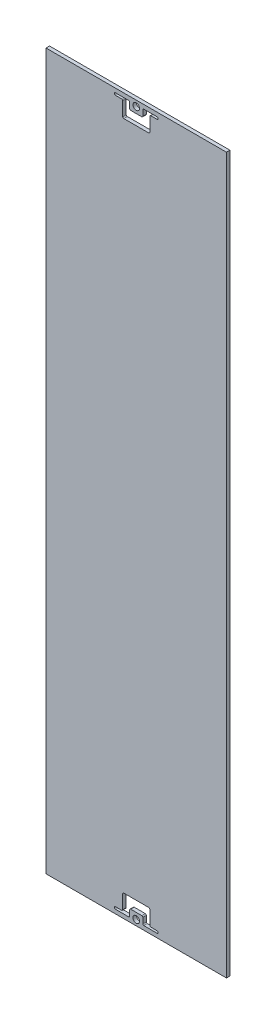
from build123d import *

# Parameters (mm, degrees)
SKETCH1_W           = 82.5
SKETCH1_H           = 327
PCB_EXTRUDE_DEPTH   = 1.6
SOLAR_HOLE_SKETCH_R = 1.5
SOLAR_HOLE_DEPTH    = 169.630876473


with BuildPart() as part:
    # Sketch1 → PCB Extrude (new body)
    with BuildSketch(Plane.XY):
        Rectangle(SKETCH1_W, SKETCH1_H)
    extrude(amount=PCB_EXTRUDE_DEPTH)

    # Solar Hole sketch → Solar Hole (cut, through all)
    with BuildSketch(Plane.XY):
        with Locations((0, -160.95)):
            Circle(SOLAR_HOLE_SKETCH_R)
        with BuildLine():
            Line((-5.7, -153.35), (5.7, -153.35))
            ThreePointArc((5.7, -153.35), (6.053553391, -153.496446609), (6.2, -153.85))
            Line((6.2, -153.85), (6.2, -160.15))
            ThreePointArc((6.2, -160.15), (6.346446609, -160.503553391), (6.7, -160.65))
            Line((6.7, -160.65), (9.5, -160.65))
            ThreePointArc((9.5, -160.65), (10, -161.15), (9.5, -161.65))
            Line((9.5, -161.65), (3.5, -161.65))
            ThreePointArc((3.5, -161.65), (3.146446609, -161.503553391), (3, -161.15))
            Line((3, -161.15), (3, -158.65))
            ThreePointArc((3, -158.65), (2.853553391, -158.296446609), (2.5, -158.15))
            Line((2.5, -158.15), (-2.5, -158.15))
            ThreePointArc((-2.5, -158.15), (-2.853553391, -158.296446609), (-3, -158.65))
            Line((-3, -158.65), (-3, -161.15))
            ThreePointArc((-3, -161.15), (-3.146446609, -161.503553391), (-3.5, -161.65))
            Line((-3.5, -161.65), (-9.5, -161.65))
            ThreePointArc((-9.5, -161.65), (-10, -161.15), (-9.5, -160.65))
            Line((-9.5, -160.65), (-6.7, -160.65))
            ThreePointArc((-6.7, -160.65), (-6.346446609, -160.503553391), (-6.2, -160.15))
            Line((-6.2, -160.15), (-6.2, -153.85))
            ThreePointArc((-6.2, -153.85), (-6.053553391, -153.496446609), (-5.7, -153.35))
        make_face()
    solar_hole = extrude(amount=SOLAR_HOLE_DEPTH, mode=Mode.SUBTRACT)

    # Mirror Solar Hole: Solar Hole across plane
    add(solar_hole.mirror(Plane.ZX), mode=Mode.SUBTRACT)


solid = part.part
